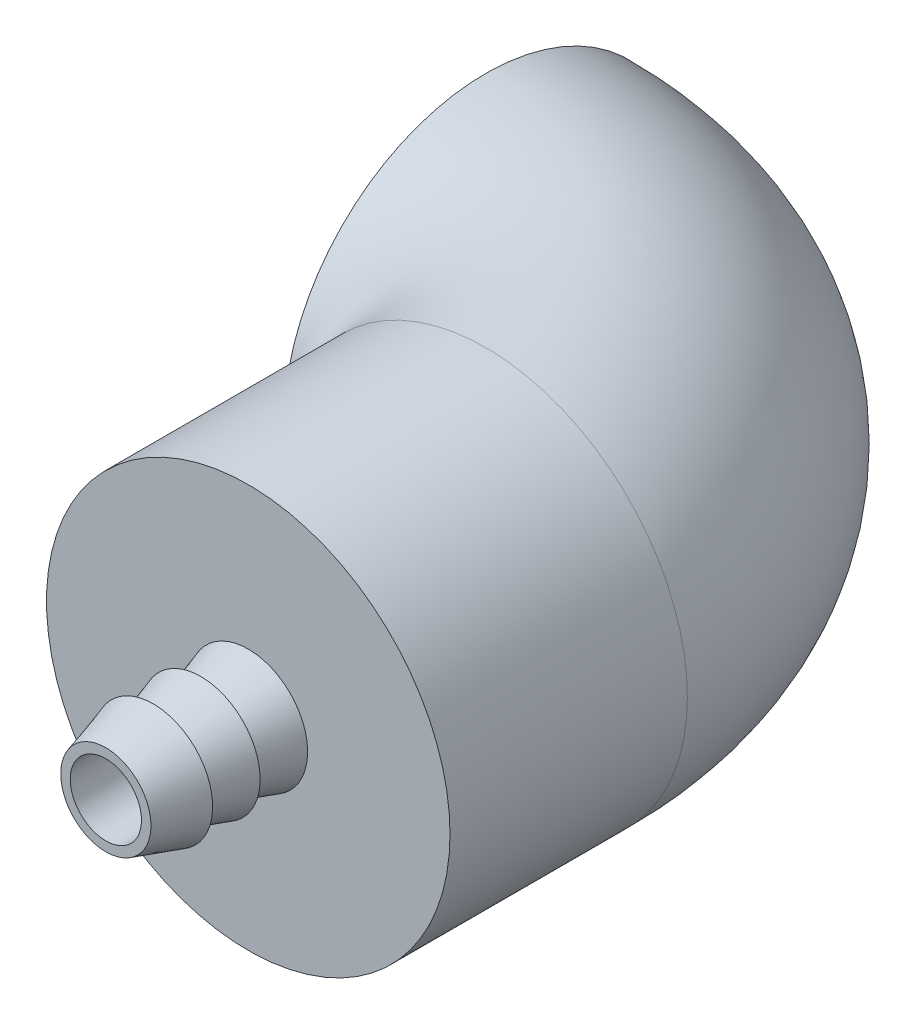
from build123d import *

# Parameters (mm, degrees)
SKETCH_2_R      = 8.5
SKETCH_2_R_2    = 8
EXTRUDE_START   = -1
SKETCH_4_R      = 8.5
SKETCH_4_R_2    = 1.5
EXTRUDE_1_DEPTH = 1


with BuildPart() as part:
    # 扫描5: sweep along a path in 草图3
    with BuildLine(Plane(origin=(0, 0, 0), x_dir=(1, 0, 0), z_dir=(0, 1, 0))) as sweep_5_path:
        Line((0, 0), (0, 10))
        ThreePointArc((0, 10), (-2.928932188, 17.071067812), (-10, 20))
    # 草图2 → 扫描5 (sweep)
    with BuildSketch(Plane.XY):
        Circle(SKETCH_2_R)
        Circle(SKETCH_2_R_2, mode=Mode.SUBTRACT)
    sweep(path=sweep_5_path.line)

    # 草图4 → 凸台-拉伸1 (add)
    with BuildSketch(Plane.XY.offset(EXTRUDE_START)):
        Circle(SKETCH_4_R)
        Circle(SKETCH_4_R_2, mode=Mode.SUBTRACT)
    extrude(amount=EXTRUDE_1_DEPTH)

    # 草图5 → 旋转1 (revolve)
    with BuildSketch(Plane(origin=(0, 0, 0), x_dir=(1, 0, 0), z_dir=(0, 1, 0))):
        Polygon((1.5, 0), (1.5, -6), (1.9, -6), (2.5, -4), (1.9, -4), (2.5, -2), (1.9, -2), (2.5, 0), align=None)
    revolve(axis=Axis((0, 0, 0), (0, 0, 1)))


solid = part.part
